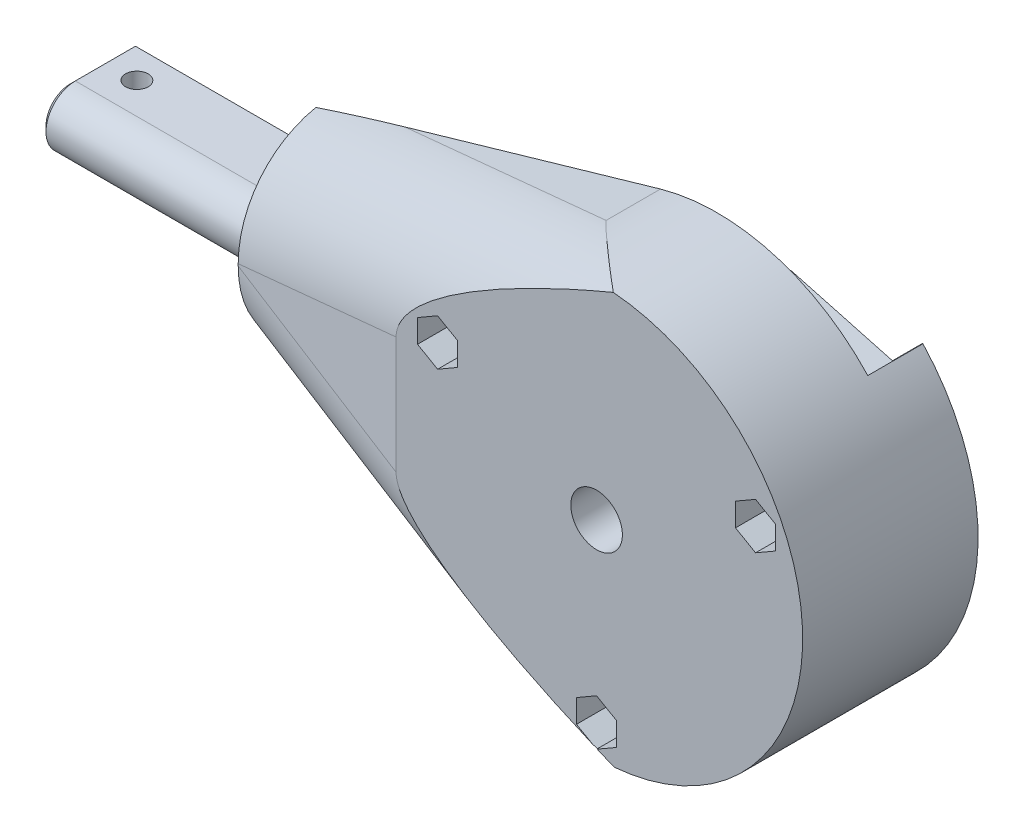
from build123d import *

# Parameters (mm, degrees)
RESSALTO_EXTRUS_O1_DEPTH = 35
CHANFRO1_SIZE            = 40
CHANFRO1_SIZE2           = 8.502262467
FILETE2_R                = 20
CORTE_EXTRUS_O2_DEPTH    = 6
CORTE_EXTRUS_O3_DEPTH    = 11
CHANFRO2_SIZE            = 10
RESSALTO_EXTRUS_O2_DEPTH = 48
CHANFRO3_SIZE            = 1
FILETE3_R                = 2
ESBO_O9_R                = 2.25
CORTE_EXTRUS_O4_DEPTH    = 342.284989024
ESBO_O10_R               = 5.15
CORTE_EXTRUS_O5_DEPTH    = 367.917618461
CORTE_EXTRUS_O7_DEPTH    = 10
ESBO_O13_R               = 2.25
CORTE_EXTRUS_O8_DEPTH    = 367.09908322


with BuildPart() as part:
    # Esboço1 → Ressalto-extrusão1 (new body)
    with BuildSketch(Plane.XY):
        with BuildLine():
            Line((-288.88140452, 80), (-220.127979697, 60.449355997))
            ThreePointArc((-220.127979697, 60.449355997), (-167.76280904, 100), (-220.127979697, 139.550644003))
            Line((-220.127979697, 139.550644003), (-288.88140452, 119.635273108))
            Line((-288.88140452, 119.635273108), (-288.88140452, 80))
        make_face()
    extrude(amount=RESSALTO_EXTRUS_O1_DEPTH)

    # Chanfro1
    chanfro1_edges = [part.edges().sort_by_distance(p)[0] for p in [
        (-288.88140452, 99.817636554, 35),
    ]]
    chanfro1_side = [part.faces().sort_by_distance(p)[0] for p in [
        (-225.798931966, 99.956743446, 35),
    ]]
    chamfer(chanfro1_edges, length=CHANFRO1_SIZE, length2=CHANFRO1_SIZE2, reference=chanfro1_side[0])

    # Filete2
    # the kernel refuses this fillet: 20 mm, written as the material it takes off along each edge
    with BuildSketch(Plane(origin=(-115.658970437, 169.81152296, 63.317302526), x_dir=(0.19213899287120792, 0.055655690116350805, -0.9797882687479528), z_dir=(-0.9411018224853822, -0.27260302876307696, -0.2000373675688854))) as filete2_piece_1:
        with BuildLine():
            CenterArc((FILETE2_R * 0.943733759019, FILETE2_R), FILETE2_R, 183.31621355, 86.68378645)
            Line((-FILETE2_R * 0.054591728164, FILETE2_R * 0.942153464743), (0, 0))
            Line((0, 0), (FILETE2_R * 0.943733759019, 0))
        make_face()
    extrude(amount=231.2501229, mode=Mode.SUBTRACT)
    with BuildSketch(Plane(origin=(-115.347800558, 30.654185994, 63.383443726), x_dir=(0.2621163849534368, 0.9634266390424966, 0.05571455754307817), z_dir=(-0.9423734554624519, 0.2679722209171675, -0.2003076615021976))) as filete2_piece_2:
        with BuildLine():
            CenterArc((FILETE2_R * 0.9446616108, FILETE2_R), FILETE2_R, 183.260002361, 86.739997639)
            Line((-FILETE2_R * 0.0537201474496, FILETE2_R * 0.943132919942), (0, 0))
            Line((0, 0), (FILETE2_R * 0.9446616108, 0))
        make_face()
    extrude(amount=231.378339467, mode=Mode.SUBTRACT)

    # Esboço6 → Corte-extrusão2 (cut)
    with BuildSketch(Plane(origin=(0, 0, 0), x_dir=(-1, 0, 0), z_dir=(0, 0, -1))):
        with BuildLine():
            Line((219.273709365, 94), (245.2234198, 138.946216915))
            Line((245.2234198, 138.946216915), (172.539389239, 138.946216915))
            Line((172.539389239, 138.946216915), (198.489099675, 94))
            ThreePointArc((198.489099675, 94), (208.88140452, 88), (219.273709365, 94))
        make_face()
    extrude(amount=-CORTE_EXTRUS_O2_DEPTH, mode=Mode.SUBTRACT)

    # Esboço7 → Corte-extrusão3 (cut)
    with BuildSketch(Plane(origin=(0, 0, 0), x_dir=(-1, 0, 0), z_dir=(0, 0, -1))):
        Polygon((179.171530951, 139.11313265), (295.618088129, 106.000524942), (295.618088129, 136.423544796), (188.948158446, 165.308096575), align=None)
    extrude(amount=-CORTE_EXTRUS_O3_DEPTH, mode=Mode.SUBTRACT)

    # Chanfro2
    # the kernel refuses this chamfer: 22.612495948, 10 mm, written as the material it takes off along each edge
    with BuildSketch(Plane(origin=(-189.392572811, 136.206689062, 11), x_dir=(0.7913619734687217, -0.6113478771924299, 0), z_dir=(0, 0, -1))) as chanfro2_piece_1:
        with BuildLine():
            Line((13.424324353, 0), (-CHANFRO2_SIZE * 0.593972278099, CHANFRO2_SIZE * 0.804485508167))
            Line((-CHANFRO2_SIZE * 0.593972278099, CHANFRO2_SIZE * 0.804485508167), (0, 0))
            ThreePointArc((0, 0), (7.133656498, -0.549382314), (13.424324353, 0))
        make_face()
    extrude(amount=40.659571502, mode=Mode.SUBTRACT)

    # Esboço8 → Ressalto-extrusão2 (add)
    with BuildSketch(Plane.ZY.offset(288.88140452)):
        with BuildLine():
            Line((0, 100.85), (12, 100.85))
            ThreePointArc((12, 100.85), (17.85, 95), (12, 89.15))
            Line((12, 89.15), (0, 89.15))
            Line((0, 89.15), (0, 100.85))
        make_face()
    extrude(amount=RESSALTO_EXTRUS_O2_DEPTH)

    # Chanfro3
    chanfro3_edges = [part.edges().sort_by_distance(p)[0] for p in [
        (-336.88140452, 89.15, 6),
        (-336.88140452, 95, 17.85),
        (-336.88140452, 100.85, 6),
    ]]
    chamfer(chanfro3_edges, length=CHANFRO3_SIZE)

    # Filete3
    filete3_edges = [part.edges().sort_by_distance(p)[0] for p in [
        (-288.88140452, 89.15, 6),
        (-288.88140452, 95, 17.85),
        (-288.88140452, 100.85, 6),
    ]]
    fillet(filete3_edges, radius=FILETE3_R)

    # Esboço9 → Corte-extrusão4 (cut, through all)
    with BuildSketch(Plane(origin=(0, 100.85, 0), x_dir=(1, 0, 0), z_dir=(0, 1, 0))):
        with Locations(Location((-329.846296891, -5.75110431, 0), (0, 0, 270))):
            Circle(ESBO_O9_R)
        with Locations(Location((-297.910035946, -5.75110431, 0), (0, 0, 270))):
            Circle(ESBO_O9_R)
    extrude(amount=-CORTE_EXTRUS_O4_DEPTH, mode=Mode.SUBTRACT)

    # Esboço10 → Corte-extrusão5 (cut, through all)
    with BuildSketch(Plane(origin=(0, 0, 0), x_dir=(-1, 0, 0), z_dir=(0, 0, -1))):
        with Locations((208.88140452, 100)):
            Circle(ESBO_O10_R)
    extrude(amount=-CORTE_EXTRUS_O5_DEPTH, mode=Mode.SUBTRACT)

    # Esboço12 → Corte-extrusão7 (cut)
    with BuildSketch(Plane.XY.offset(35)):
        Polygon((-240.599798192, 119.415541755), (-244.599798192, 117.106140678), (-244.599798192, 112.487338525), (-240.599798192, 110.177937448), (-236.599798192, 112.487338525), (-236.599798192, 117.106140678), align=None)
        Polygon((-208.88140452, 69.618802154), (-212.88140452, 67.309401077), (-212.88140452, 62.690598923), (-208.88140452, 60.381197846), (-204.88140452, 62.690598923), (-204.88140452, 67.309401077), align=None)
        Polygon((-177.163010847, 119.415541755), (-181.163010847, 117.106140678), (-181.163010847, 112.487338525), (-177.163010847, 110.177937448), (-173.163010847, 112.487338525), (-173.163010847, 117.106140678), align=None)
    extrude(amount=-CORTE_EXTRUS_O7_DEPTH, mode=Mode.SUBTRACT)

    # Esboço13 → Corte-extrusão8 (cut, through all)
    with BuildSketch(Plane.XY.offset(25)):
        with Locations((-177.163010847, 114.796739602)):
            Circle(ESBO_O13_R)
        with Locations((-208.88140452, 65)):
            Circle(ESBO_O13_R)
        with Locations((-240.599798192, 114.796739602)):
            Circle(ESBO_O13_R)
    extrude(amount=-CORTE_EXTRUS_O8_DEPTH, mode=Mode.SUBTRACT)


solid = part.part
